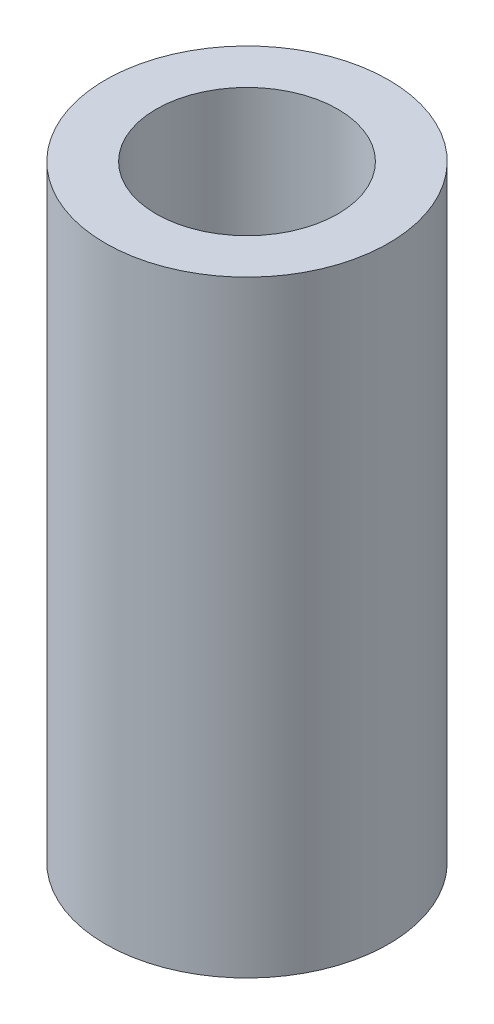
from build123d import *

# Parameters (mm, degrees)
SKETCH1_R           = 7.5
BOSS_EXTRUDE1_DEPTH = 32.155843941
SKETCH2_R           = 4.812218207
CUT_EXTRUDE1_DEPTH  = 34.859980797


with BuildPart() as part:
    # Sketch1 → Boss-Extrude1 (new body)
    with BuildSketch(Plane(origin=(0, 0, 0), x_dir=(1, 0, 0), z_dir=(0, 1, 0))):
        Circle(SKETCH1_R)
    extrude(amount=BOSS_EXTRUDE1_DEPTH)

    # Sketch2 → Cut-Extrude1 (cut, through all)
    with BuildSketch(Plane(origin=(0, 0, 0), x_dir=(1, 0, 0), z_dir=(0, 1, 0))):
        Circle(SKETCH2_R)
    extrude(amount=CUT_EXTRUDE1_DEPTH, mode=Mode.SUBTRACT)


solid = part.part
